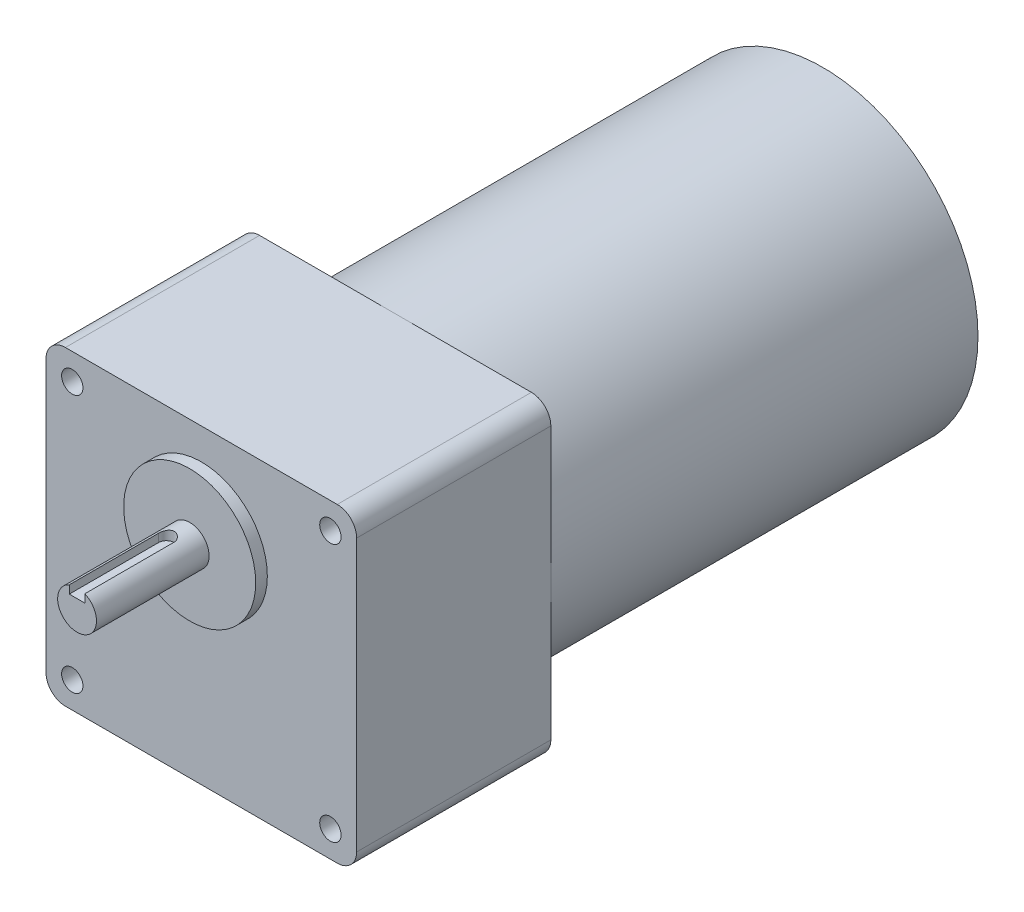
from build123d import *

# Parameters (mm, degrees)
SKETCH_1_W          = 80
SKETCH_1_H          = 80
EXTRUDE_1_DEPTH     = 12
SKETCH_2_R          = 17
EXTRUDE_2_DEPTH     = 3
SKETCH_3_R          = 5
EXTRUDE_3_DEPTH     = 29
CUT_EXTRUDE_1_DEPTH = 23
CUT_EXTRUDE_4_DEPTH = 2.5
SKETCH_7_W          = 80
SKETCH_7_H          = 80
EXTRUDE_6_DEPTH     = 38
SKETCH_10_R         = 40
EXTRUDE_7_DEPTH     = 110
SKETCH_11_R         = 14
EXTRUDE_8_DEPTH     = 4.5
SKETCH_12_R         = 2.75
CUT_EXTRUDE_5_DEPTH = 174.954735492
FILLET_1_R          = 5


with BuildPart() as part:
    # 스케치1 → 보스-돌출1 (new body)
    with BuildSketch(Plane.XY):
        Rectangle(SKETCH_1_W, SKETCH_1_H)
    extrude(amount=EXTRUDE_1_DEPTH)

    # 스케치2 → 보스-돌출2 (add)
    with BuildSketch(Plane.XY.offset(12)):
        with Locations((0, 15)):
            Circle(SKETCH_2_R)
    extrude(amount=EXTRUDE_2_DEPTH)

    # 스케치3 → 보스-돌출3 (add)
    with BuildSketch(Plane.XY.offset(15)):
        with Locations((0, 15)):
            Circle(SKETCH_3_R)
    extrude(amount=EXTRUDE_3_DEPTH)

    # 스케치4 → 컷-돌출1 (cut)
    with BuildSketch(Plane.XY.offset(44)):
        Polygon((0, 17.5), (-2, 17.5), (-2, 20.912683476), (2, 20.912683476), (2, 17.5), align=None)
    extrude(amount=-CUT_EXTRUDE_1_DEPTH, mode=Mode.SUBTRACT)

    # 스케치6 → 컷-돌출4 (cut)
    with BuildSketch(Plane(origin=(0, 20, 0), x_dir=(1, 0, 0), z_dir=(0, 1, 0))):
        with BuildLine():
            Line((-2, -21), (-2, -52.407669752))
            Line((-2, -52.407669752), (2, -52.407669752))
            Line((2, -52.407669752), (2, -21))
            ThreePointArc((2, -21), (0, -19), (-2, -21))
        make_face()
    extrude(amount=-CUT_EXTRUDE_4_DEPTH, mode=Mode.SUBTRACT)

    # 스케치7 → 보스-돌출6 (add)
    with BuildSketch(Plane(origin=(0, 0, 0), x_dir=(-1, 0, 0), z_dir=(0, 0, -1))):
        Rectangle(SKETCH_7_W, SKETCH_7_H)
    extrude(amount=EXTRUDE_6_DEPTH)

    # 스케치10 → 보스-돌출7 (add)
    with BuildSketch(Plane(origin=(0, 0, -38), x_dir=(-1, 0, 0), z_dir=(0, 0, -1))):
        Circle(SKETCH_10_R)
    extrude(amount=EXTRUDE_7_DEPTH)

    # 스케치11 → 보스-돌출8 (add)
    with BuildSketch(Plane(origin=(0, 0, -148), x_dir=(-1, 0, 0), z_dir=(0, 0, -1))):
        Circle(SKETCH_11_R)
    extrude(amount=EXTRUDE_8_DEPTH)

    # 스케치12 → 컷-돌출5 (cut, through all)
    with BuildSketch(Plane.XY.offset(12)):
        with Locations((33.234018716, 33.234018716)):
            Circle(SKETCH_12_R)
        with Locations((-33.234018716, 33.234018716)):
            Circle(SKETCH_12_R)
        with Locations((-33.234018716, -33.234018716)):
            Circle(SKETCH_12_R)
        with Locations((33.234018716, -33.234018716)):
            Circle(SKETCH_12_R)
    extrude(amount=-CUT_EXTRUDE_5_DEPTH, mode=Mode.SUBTRACT)

    # 필렛1
    fillet_1_edges = [part.edges().sort_by_distance(p)[0] for p in [
        (-40, 40, -13),
        (-40, -40, -13),
        (40, -40, -13),
        (40, 40, -13),
    ]]
    fillet(fillet_1_edges, radius=FILLET_1_R)


solid = part.part
